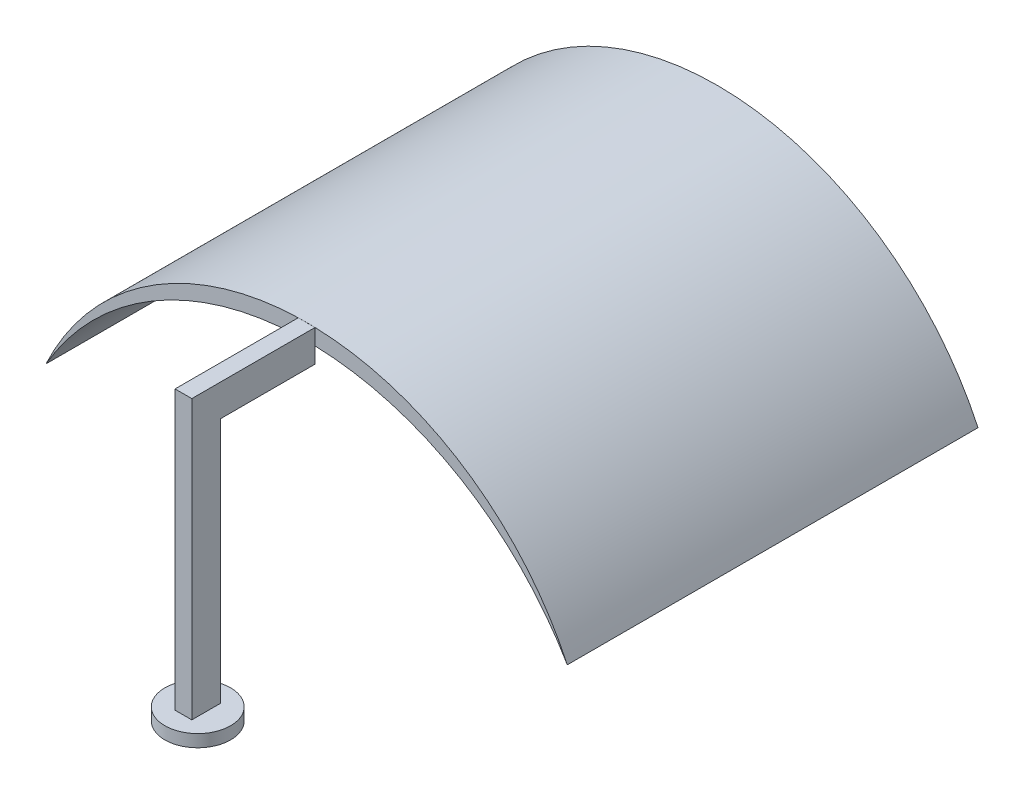
from build123d import *

# Parameters (mm, degrees)
BOSS_EXTRUDE1_DEPTH = 500
SKETCH2_W           = 20.407517626
SKETCH2_H           = 38.739476433
BOSS_EXTRUDE2_DEPTH = 150
SKETCH3_W           = 20.407517626
SKETCH3_H           = 34.839681329
BOSS_EXTRUDE3_DEPTH = 300
SKETCH4_R           = 40
BOSS_EXTRUDE4_DEPTH = 15


with BuildPart() as part:
    # Sketch1 → Boss-Extrude1 (new body)
    with BuildSketch(Plane.XY):
        with BuildLine():
            ThreePointArc((317.310666276, 147.695433469), (0, 350), (-317.310666276, 147.695433469))
            ThreePointArc((-317.310666276, 147.695433469), (0, 330.481492032), (317.310666276, 147.695433469))
        make_face()
    extrude(amount=BOSS_EXTRUDE1_DEPTH)

    # Sketch2 → Boss-Extrude2 (add)
    with BuildSketch(Plane.XY.offset(500)):
        with Locations((0, 330.481492032)):
            Rectangle(SKETCH2_W, SKETCH2_H)
    extrude(amount=BOSS_EXTRUDE2_DEPTH)

    # Sketch3 → Boss-Extrude3 (add)
    with BuildSketch(Plane.XZ.offset(-311.111753815)):
        with Locations((0, 632.580159335)):
            Rectangle(SKETCH3_W, SKETCH3_H)
    extrude(amount=BOSS_EXTRUDE3_DEPTH)

    # Sketch4 → Boss-Extrude4 (add)
    with BuildSketch(Plane.XZ.offset(-11.111753815)):
        with Locations((0, 632.580159336)):
            Circle(SKETCH4_R)
    extrude(amount=BOSS_EXTRUDE4_DEPTH)


solid = part.part
